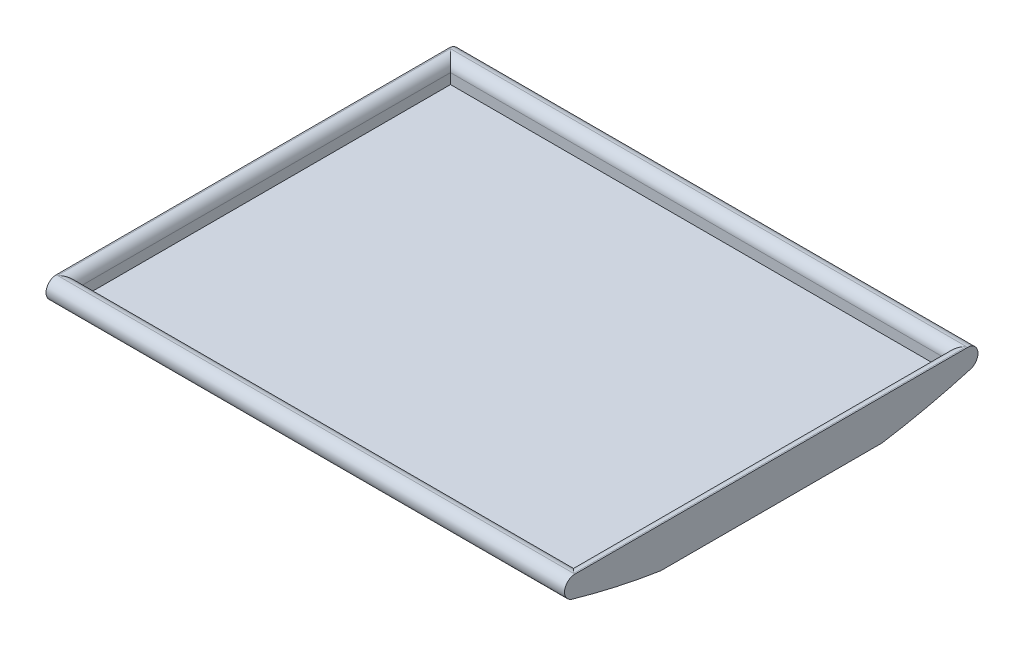
from build123d import *

# Parameters (mm, degrees)
EXTRUDE_1_DEPTH     = 50
SKETCH_2_W          = 47.752029062465894
SKETCH_2_H          = 35.88941973747437
CUT_EXTRUDE_1_DEPTH = 2
FILLET_1_R          = 1
SCALE_1_SCALE       = 0.4


with BuildPart() as part:
    # 草图1 → 凸台-拉伸1 (new body)
    with BuildSketch(Plane(origin=(0, 0, 0), x_dir=(0, 0, -1), z_dir=(1, 0, 0))):
        with BuildLine():
            Line((6.066042211617314, 0), (43.933957788382685, 0))
            ThreePointArc((43.933957788382685, 0), (44.92401323811772, -0.85932233137432), (44.212515173340435, -1.9604195871000956))
            ThreePointArc((44.212515173340435, -1.9604195871000956), (39.96661362209007, -3.046903416934029), (35.66027972203156, -3.861529365825664))
            Line((35.66027972203156, -3.861529365825664), (14.339720277968421, -3.861529365825664))
            ThreePointArc((14.339720277968421, -3.861529365825664), (10.03338637790992, -3.046903416934029), (5.787484826659573, -1.9604195871000956))
            ThreePointArc((5.787484826659573, -1.9604195871000956), (5.075986761882271, -0.8593223313743236), (6.066042211617314, 0))
        make_face()
    extrude(amount=EXTRUDE_1_DEPTH)

    # 草图2 → 切除-拉伸1 (cut)
    with BuildSketch(Plane(origin=(0, 0, 0), x_dir=(1, 0, 0), z_dir=(0, 1, 0))):
        with Locations((25, 25.000000000000007)):
            Rectangle(SKETCH_2_W, SKETCH_2_H)
    extrude(amount=-CUT_EXTRUDE_1_DEPTH, mode=Mode.SUBTRACT)

    # 圆角1
    # the kernel refuses this fillet: 1 mm, written as the material it takes off along each edge
    with BuildSketch(Plane(origin=(1.1239854687670539, 0, -7.055290131262825), x_dir=(-1, 0, 0), z_dir=(0, 0, -1))) as fillet_1_piece_1:
        with BuildLine():
            CenterArc((FILLET_1_R, -FILLET_1_R), FILLET_1_R, 90, 90)
            Line((0, -FILLET_1_R), (-FILLET_1_R * 0.02, -FILLET_1_R))
            Line((-FILLET_1_R * 0.02, -FILLET_1_R), (-FILLET_1_R * 0.02, FILLET_1_R * 0.02))
            Line((-FILLET_1_R * 0.02, FILLET_1_R * 0.02), (FILLET_1_R, FILLET_1_R * 0.02))
            Line((FILLET_1_R, FILLET_1_R * 0.02), (FILLET_1_R, 0))
        make_face()
    extrude(amount=35.88941973747437, mode=Mode.SUBTRACT)
    with BuildSketch(Plane(origin=(48.87601453123295, 0, -7.055290131262825), x_dir=(0, 0, 1), z_dir=(-1, 0, 0))) as fillet_1_piece_2:
        with BuildLine():
            CenterArc((FILLET_1_R, -FILLET_1_R), FILLET_1_R, 90, 90)
            Line((0, -FILLET_1_R), (-FILLET_1_R * 0.02, -FILLET_1_R))
            Line((-FILLET_1_R * 0.02, -FILLET_1_R), (-FILLET_1_R * 0.02, FILLET_1_R * 0.02))
            Line((-FILLET_1_R * 0.02, FILLET_1_R * 0.02), (FILLET_1_R, FILLET_1_R * 0.02))
            Line((FILLET_1_R, FILLET_1_R * 0.02), (FILLET_1_R, 0))
        make_face()
    extrude(amount=47.752029062465894, mode=Mode.SUBTRACT)
    with BuildSketch(Plane(origin=(48.87601453123295, 0, -42.94470986873719), x_dir=(1, 0, 0), z_dir=(0, 0, 1))) as fillet_1_piece_3:
        with BuildLine():
            CenterArc((FILLET_1_R, -FILLET_1_R), FILLET_1_R, 90, 90)
            Line((0, -FILLET_1_R), (-FILLET_1_R * 0.02, -FILLET_1_R))
            Line((-FILLET_1_R * 0.02, -FILLET_1_R), (-FILLET_1_R * 0.02, FILLET_1_R * 0.02))
            Line((-FILLET_1_R * 0.02, FILLET_1_R * 0.02), (FILLET_1_R, FILLET_1_R * 0.02))
            Line((FILLET_1_R, FILLET_1_R * 0.02), (FILLET_1_R, 0))
        make_face()
    extrude(amount=35.88941973747437, mode=Mode.SUBTRACT)
    with BuildSketch(Plane(origin=(1.1239854687670539, 0, -42.94470986873719), x_dir=(0, 0, -1), z_dir=(1, 0, 0))) as fillet_1_piece_4:
        with BuildLine():
            CenterArc((FILLET_1_R, -FILLET_1_R), FILLET_1_R, 90, 90)
            Line((0, -FILLET_1_R), (-FILLET_1_R * 0.02, -FILLET_1_R))
            Line((-FILLET_1_R * 0.02, -FILLET_1_R), (-FILLET_1_R * 0.02, FILLET_1_R * 0.02))
            Line((-FILLET_1_R * 0.02, FILLET_1_R * 0.02), (FILLET_1_R, FILLET_1_R * 0.02))
            Line((FILLET_1_R, FILLET_1_R * 0.02), (FILLET_1_R, 0))
        make_face()
    extrude(amount=47.752029062465894, mode=Mode.SUBTRACT)
    with BuildSketch(Plane(origin=(1.1239854687670539, 0, -4.555290131262826), x_dir=(-1, 0, 0), z_dir=(0, 0, -1))) as fillet_1_piece_5a_section:
        with BuildLine():
            CenterArc((FILLET_1_R, -FILLET_1_R), FILLET_1_R, 90, 90)
            Line((0, -FILLET_1_R), (-FILLET_1_R * 0.02, -FILLET_1_R))
            Line((-FILLET_1_R * 0.02, -FILLET_1_R), (-FILLET_1_R * 0.02, FILLET_1_R * 0.02))
            Line((-FILLET_1_R * 0.02, FILLET_1_R * 0.02), (FILLET_1_R, FILLET_1_R * 0.02))
            Line((FILLET_1_R, FILLET_1_R * 0.02), (FILLET_1_R, 0))
        make_face()
    fillet_1_piece_5a = extrude(amount=38.38941973747437, mode=Mode.PRIVATE)
    fillet_1_piece_5a = split(fillet_1_piece_5a, bisect_by=Plane(origin=(0.8975903545002311, -0.2263951142668261, -7.055290131262825), z_dir=(0, 0, 1)), keep=Keep.TOP, mode=Mode.PRIVATE)
    with BuildSketch(Plane(origin=(48.87601453123295, 0, -7.055290131262825), x_dir=(0, 0, 1), z_dir=(-1, 0, 0))) as fillet_1_piece_5b_section:
        with BuildLine():
            CenterArc((FILLET_1_R, -FILLET_1_R), FILLET_1_R, 90, 90)
            Line((0, -FILLET_1_R), (-FILLET_1_R * 0.02, -FILLET_1_R))
            Line((-FILLET_1_R * 0.02, -FILLET_1_R), (-FILLET_1_R * 0.02, FILLET_1_R * 0.02))
            Line((-FILLET_1_R * 0.02, FILLET_1_R * 0.02), (FILLET_1_R, FILLET_1_R * 0.02))
            Line((FILLET_1_R, FILLET_1_R * 0.02), (FILLET_1_R, 0))
        make_face()
    fillet_1_piece_5b = extrude(amount=50.252029062465894, mode=Mode.PRIVATE)
    fillet_1_piece_5b = split(fillet_1_piece_5b, bisect_by=Plane(origin=(1.1239854687670539, -0.22639511426682482, -6.828895016995999), z_dir=(-1, 0, 0)), keep=Keep.TOP, mode=Mode.PRIVATE)
    fillet_1_piece_5 = fillet_1_piece_5a & fillet_1_piece_5b
    add(fillet_1_piece_5, mode=Mode.SUBTRACT)
    with BuildSketch(Plane(origin=(1.1239854687670539, 0, -7.055290131262825), x_dir=(-1, 0, 0), z_dir=(0, 0, -1))) as fillet_1_piece_6a_section:
        with BuildLine():
            CenterArc((FILLET_1_R, -FILLET_1_R), FILLET_1_R, 90, 90)
            Line((0, -FILLET_1_R), (-FILLET_1_R * 0.02, -FILLET_1_R))
            Line((-FILLET_1_R * 0.02, -FILLET_1_R), (-FILLET_1_R * 0.02, FILLET_1_R * 0.02))
            Line((-FILLET_1_R * 0.02, FILLET_1_R * 0.02), (FILLET_1_R, FILLET_1_R * 0.02))
            Line((FILLET_1_R, FILLET_1_R * 0.02), (FILLET_1_R, 0))
        make_face()
    fillet_1_piece_6a = extrude(amount=38.38941973747437, mode=Mode.PRIVATE)
    fillet_1_piece_6a = split(fillet_1_piece_6a, bisect_by=Plane(origin=(0.8975903545002285, -0.22639511426682538, -42.94470986873719), z_dir=(0, 0, -1)), keep=Keep.TOP, mode=Mode.PRIVATE)
    with BuildSketch(Plane(origin=(-1.3760145312329461, 0, -42.94470986873719), x_dir=(0, 0, -1), z_dir=(1, 0, 0))) as fillet_1_piece_6b_section:
        with BuildLine():
            CenterArc((FILLET_1_R, -FILLET_1_R), FILLET_1_R, 90, 90)
            Line((0, -FILLET_1_R), (-FILLET_1_R * 0.02, -FILLET_1_R))
            Line((-FILLET_1_R * 0.02, -FILLET_1_R), (-FILLET_1_R * 0.02, FILLET_1_R * 0.02))
            Line((-FILLET_1_R * 0.02, FILLET_1_R * 0.02), (FILLET_1_R, FILLET_1_R * 0.02))
            Line((FILLET_1_R, FILLET_1_R * 0.02), (FILLET_1_R, 0))
        make_face()
    fillet_1_piece_6b = extrude(amount=50.252029062465894, mode=Mode.PRIVATE)
    fillet_1_piece_6b = split(fillet_1_piece_6b, bisect_by=Plane(origin=(1.1239854687670539, -0.22639511426682907, -43.171104983004014), z_dir=(-1, 0, 0)), keep=Keep.TOP, mode=Mode.PRIVATE)
    fillet_1_piece_6 = fillet_1_piece_6a & fillet_1_piece_6b
    add(fillet_1_piece_6, mode=Mode.SUBTRACT)
    with BuildSketch(Plane(origin=(51.37601453123295, 0, -7.055290131262825), x_dir=(0, 0, 1), z_dir=(-1, 0, 0))) as fillet_1_piece_7a_section:
        with BuildLine():
            CenterArc((FILLET_1_R, -FILLET_1_R), FILLET_1_R, 90, 90)
            Line((0, -FILLET_1_R), (-FILLET_1_R * 0.02, -FILLET_1_R))
            Line((-FILLET_1_R * 0.02, -FILLET_1_R), (-FILLET_1_R * 0.02, FILLET_1_R * 0.02))
            Line((-FILLET_1_R * 0.02, FILLET_1_R * 0.02), (FILLET_1_R, FILLET_1_R * 0.02))
            Line((FILLET_1_R, FILLET_1_R * 0.02), (FILLET_1_R, 0))
        make_face()
    fillet_1_piece_7a = extrude(amount=50.252029062465894, mode=Mode.PRIVATE)
    fillet_1_piece_7a = split(fillet_1_piece_7a, bisect_by=Plane(origin=(48.87601453123295, -0.22639511426682557, -6.828895016996), z_dir=(1, 0, 0)), keep=Keep.TOP, mode=Mode.PRIVATE)
    with BuildSketch(Plane(origin=(48.87601453123295, 0, -42.94470986873719), x_dir=(1, 0, 0), z_dir=(0, 0, 1))) as fillet_1_piece_7b_section:
        with BuildLine():
            CenterArc((FILLET_1_R, -FILLET_1_R), FILLET_1_R, 90, 90)
            Line((0, -FILLET_1_R), (-FILLET_1_R * 0.02, -FILLET_1_R))
            Line((-FILLET_1_R * 0.02, -FILLET_1_R), (-FILLET_1_R * 0.02, FILLET_1_R * 0.02))
            Line((-FILLET_1_R * 0.02, FILLET_1_R * 0.02), (FILLET_1_R, FILLET_1_R * 0.02))
            Line((FILLET_1_R, FILLET_1_R * 0.02), (FILLET_1_R, 0))
        make_face()
    fillet_1_piece_7b = extrude(amount=38.38941973747437, mode=Mode.PRIVATE)
    fillet_1_piece_7b = split(fillet_1_piece_7b, bisect_by=Plane(origin=(49.10240964549977, -0.22639511426682904, -7.055290131262825), z_dir=(0, 0, 1)), keep=Keep.TOP, mode=Mode.PRIVATE)
    fillet_1_piece_7 = fillet_1_piece_7a & fillet_1_piece_7b
    add(fillet_1_piece_7, mode=Mode.SUBTRACT)
    with BuildSketch(Plane(origin=(48.87601453123295, 0, -45.44470986873719), x_dir=(1, 0, 0), z_dir=(0, 0, 1))) as fillet_1_piece_8a_section:
        with BuildLine():
            CenterArc((FILLET_1_R, -FILLET_1_R), FILLET_1_R, 90, 90)
            Line((0, -FILLET_1_R), (-FILLET_1_R * 0.02, -FILLET_1_R))
            Line((-FILLET_1_R * 0.02, -FILLET_1_R), (-FILLET_1_R * 0.02, FILLET_1_R * 0.02))
            Line((-FILLET_1_R * 0.02, FILLET_1_R * 0.02), (FILLET_1_R, FILLET_1_R * 0.02))
            Line((FILLET_1_R, FILLET_1_R * 0.02), (FILLET_1_R, 0))
        make_face()
    fillet_1_piece_8a = extrude(amount=38.38941973747437, mode=Mode.PRIVATE)
    fillet_1_piece_8a = split(fillet_1_piece_8a, bisect_by=Plane(origin=(49.10240964549977, -0.2263951142668292, -42.94470986873719), z_dir=(0, 0, -1)), keep=Keep.TOP, mode=Mode.PRIVATE)
    with BuildSketch(Plane(origin=(1.1239854687670539, 0, -42.94470986873719), x_dir=(0, 0, -1), z_dir=(1, 0, 0))) as fillet_1_piece_8b_section:
        with BuildLine():
            CenterArc((FILLET_1_R, -FILLET_1_R), FILLET_1_R, 90, 90)
            Line((0, -FILLET_1_R), (-FILLET_1_R * 0.02, -FILLET_1_R))
            Line((-FILLET_1_R * 0.02, -FILLET_1_R), (-FILLET_1_R * 0.02, FILLET_1_R * 0.02))
            Line((-FILLET_1_R * 0.02, FILLET_1_R * 0.02), (FILLET_1_R, FILLET_1_R * 0.02))
            Line((FILLET_1_R, FILLET_1_R * 0.02), (FILLET_1_R, 0))
        make_face()
    fillet_1_piece_8b = extrude(amount=50.252029062465894, mode=Mode.PRIVATE)
    fillet_1_piece_8b = split(fillet_1_piece_8b, bisect_by=Plane(origin=(48.87601453123295, -0.22639511426682885, -43.17110498300402), z_dir=(1, 0, 0)), keep=Keep.TOP, mode=Mode.PRIVATE)
    fillet_1_piece_8 = fillet_1_piece_8a & fillet_1_piece_8b
    add(fillet_1_piece_8, mode=Mode.SUBTRACT)


with BuildPart() as part_1:
    # 缩放比例1: scaled about (25, -2.588659759, -25)
    add(part.part.scale(SCALE_1_SCALE).moved(Location((15, -1.5531958554, -15))))


solid = part_1.part
